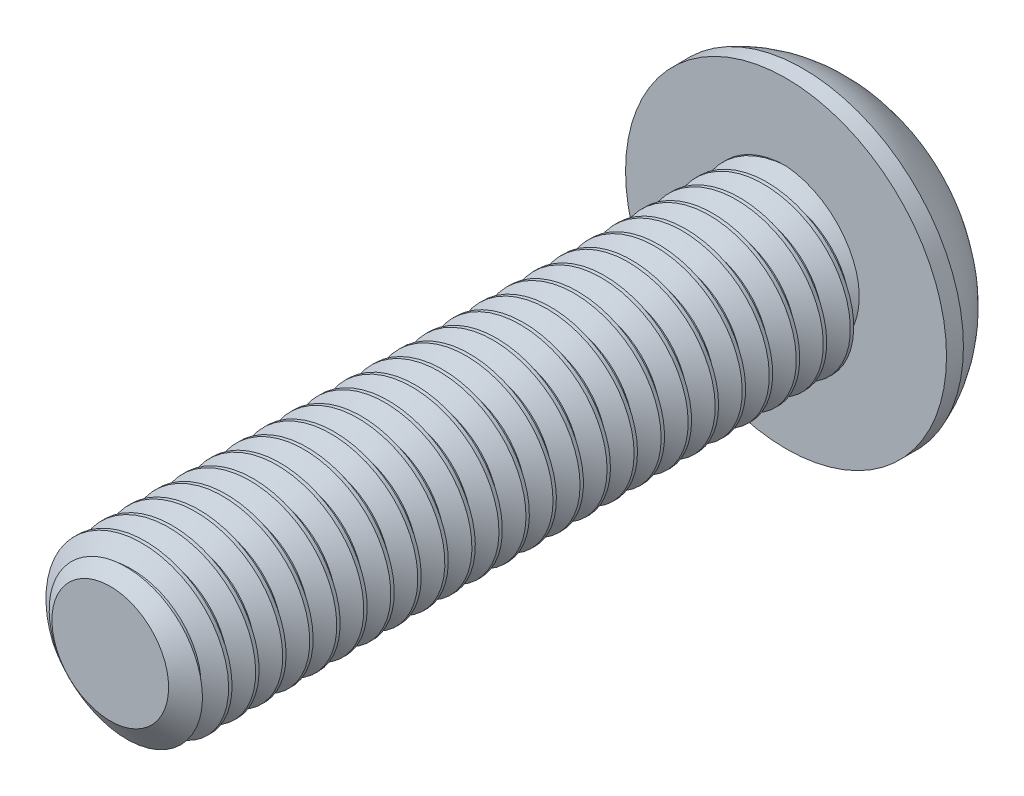
from build123d import *

# Parameters (mm, degrees)
SKETCH1_R          = 2.5
EXTRUDE1_DEPTH     = 20
CUT_SWEEP1_PITCH   = 0.7999999999999963
SKETCH6_R          = 4.75
EXTRUDE2_DEPTH     = 2.75
CUT_EXTRUDE1_DEPTH = 2.25
SKETCH8_R          = 1.7320508075688772
CUT_EXTRUDE2_DEPTH = 24.721035104944306
CUT_EXTRUDE2_TAPER = 45.0000000000001


with BuildPart() as part:
    # Sketch1 → Extrude1 (new body)
    with BuildSketch(Plane.XY):
        Circle(SKETCH1_R)
    extrude(amount=-EXTRUDE1_DEPTH)

    # Cut-Sweep1: the profile of Sketch3 profile screwed along a right-hand helix of 26 turns, 6 arcs to a turn; built about Z, then put on its axis
    cut_sweep1_z = Axis((0, 0, 0), (0, 0, 1))
    cut_sweep1_corners = [(2.5003, 0, -0.700173205), (1.980384758, 0, -0.4), (1.980384758, 0, -0.3), (2.5003, 0, 0.000173205)]
    with BuildLine(mode=Mode.PRIVATE) as cut_sweep1_profile:
        Line(cut_sweep1_corners[0], cut_sweep1_corners[1])
        Line(cut_sweep1_corners[1], cut_sweep1_corners[2])
        Line(cut_sweep1_corners[2], cut_sweep1_corners[3])
        Line(cut_sweep1_corners[3], cut_sweep1_corners[0])
    cut_sweep1_cap = Face(cut_sweep1_profile.wire())
    cut_sweep1_turn_angles = [0, 30, 60, 90, 120, 150, 180, 210, 240, 270, 300, 330, 360]
    cut_sweep1_turn_weights = [1, 0.8660254037844387, 1, 0.8660254037844387, 1, 0.8660254037844387, 1, 0.8660254037844387, 1, 0.8660254037844387, 1, 0.8660254037844387, 1]
    cut_sweep1_turn_rails = [Edge.make_bspline([Vector(p[0], p[1], 0).rotate(cut_sweep1_z, cut_sweep1_turn_angles[k]) / cut_sweep1_turn_weights[k] + Vector(0, 0, p[2] + CUT_SWEEP1_PITCH * cut_sweep1_turn_angles[k] / 360) for k in range(13)], [0, 0, 0, 1, 1, 2, 2, 3, 3, 4, 4, 5, 5, 6, 6, 6], 2, cut_sweep1_turn_weights) for p in cut_sweep1_corners]
    cut_sweep1_turn_sides = [Face.make_surface_from_curves(cut_sweep1_turn_rails[p[0]], cut_sweep1_turn_rails[p[1]]) for p in [(0, 1), (1, 2), (2, 3), (3, 0)]]
    cut_sweep1 = Plane(origin=(0, 0, 0), x_dir=(-3.49e-15, 1, 0), z_dir=(0, 0, -1)) * Solid(Shell([*[p.moved(Location((0, 0, CUT_SWEEP1_PITCH * i))) for i in range(26) for p in cut_sweep1_turn_sides], cut_sweep1_cap, cut_sweep1_cap.rotate(cut_sweep1_z, 9360).moved(Location((0, 0, CUT_SWEEP1_PITCH * 9360 / 360)))]))
    add(cut_sweep1, mode=Mode.SUBTRACT)

    # Sketch4 → Cut-Revolve1 (revolve, cut)
    with BuildSketch(Plane(origin=(0, 0, 0), x_dir=(0, 0, -1), z_dir=(1, 0, 0)), mode=Mode.PRIVATE) as cut_revolve1_sk:
        Polygon((0.5416912243118478, 2.5), (0, 1.7263847577293348), (0, 2.5), align=None)
    revolve(cut_revolve1_sk.sketch.rotate(Axis((0, 0, 0), (0, 0, -1)), 260.43858876), axis=Axis((0, 0, 0), (0, 0, -1)), mode=Mode.SUBTRACT)

    # Sketch6 → Extrude2 (add)
    with BuildSketch(Plane(origin=(0, 0, -20), x_dir=(-1, 0, 0), z_dir=(0, 0, -1))):
        Circle(SKETCH6_R)
    extrude(amount=EXTRUDE2_DEPTH)

    # Sketch10 → Cut-Revolve2 (revolve, cut)
    with BuildSketch(Plane(origin=(0, 0, 0), x_dir=(0, 0, -1), z_dir=(1, 0, 0)), mode=Mode.PRIVATE) as cut_revolve2_sk:
        with BuildLine():
            Line((20.5, 4.75), (20.500000000000004, 5.25))
            Line((20.500000000000004, 5.25), (23.25, 5.25))
            Line((23.25, 5.25), (23.25, 1.5000000000000004))
            Line((23.25, 1.5000000000000004), (22.75, 1.5000000000000004))
            ThreePointArc((22.75, 1.5000000000000004), (22.132611776540898, 3.4764235376052377), (20.5, 4.75))
        make_face()
    revolve(cut_revolve2_sk.sketch.rotate(Axis((0, 0, 0), (0, 0, -1)), 90), axis=Axis((0, 0, 0), (0, 0, -1)), mode=Mode.SUBTRACT)

    # Sketch7 → Cut-Extrude1 (cut)
    with BuildSketch(Plane(origin=(0, 0, -22.75), x_dir=(-1, 0, 0), z_dir=(0, 0, -1))):
        Polygon((-9e-17, 1.732050807568877), (-1.4999999999999998, 0.8660254037844387), (-1.4999999999999998, -0.8660254037844388), (-2.1e-16, -1.7320508075688774), (1.5000000000000002, -0.8660254037844387), (1.4999999999999996, 0.8660254037844388), align=None)
    extrude(amount=-CUT_EXTRUDE1_DEPTH, mode=Mode.SUBTRACT)

    # Sketch8 → Cut-Extrude2 (cut, through all)
    with BuildSketch(Plane.XY.offset(-22.75)):
        Circle(SKETCH8_R)
    extrude(amount=CUT_EXTRUDE2_DEPTH, taper=CUT_EXTRUDE2_TAPER, mode=Mode.SUBTRACT)


solid = part.part
